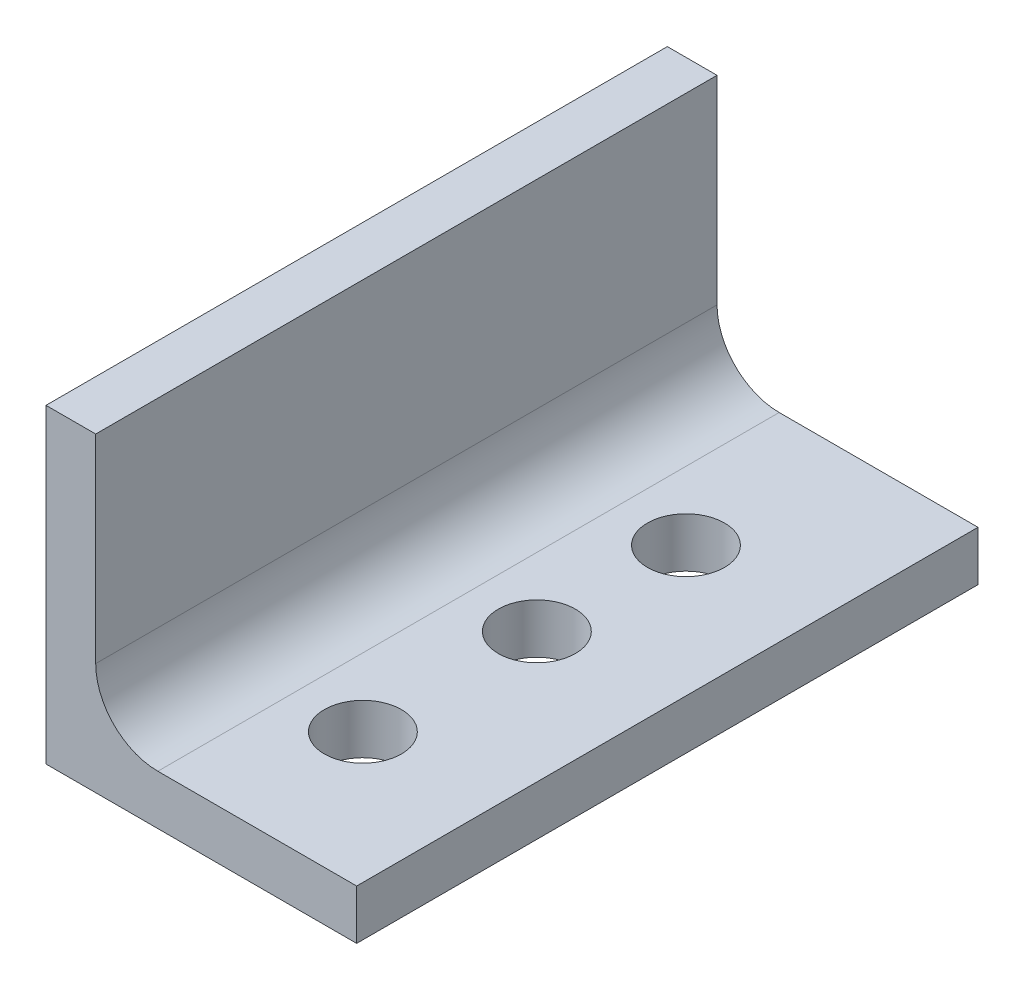
from build123d import *

# Parameters (mm, degrees)
BOSS_EXTRUDE1_DEPTH = 12.7
SKETCH3_R           = 0.7874
CUT_EXTRUDE1_DEPTH  = 2.54
FILLET1_R           = 1.27


with BuildPart() as part:
    # Sketch1 → Boss-Extrude1 (new body)
    with BuildSketch(Plane.XY):
        Polygon((-6.35, 6.35), (-6.35, 0), (0, 0), (0, 1.016), (-5.334, 1.016), (-5.334, 6.35), align=None)
    extrude(amount=BOSS_EXTRUDE1_DEPTH)

    # Sketch3 → Cut-Extrude1 (cut)
    with BuildSketch(Plane(origin=(0, 1.016, 0), x_dir=(1, 0, 0), z_dir=(0, 1, 0))):
        with Locations((-2.667, -9.906)):
            Circle(SKETCH3_R)
        with Locations((-2.667, -6.35)):
            Circle(SKETCH3_R)
        with Locations((-2.667, -3.302)):
            Circle(SKETCH3_R)
    extrude(amount=-CUT_EXTRUDE1_DEPTH, mode=Mode.SUBTRACT)

    # Fillet1
    fillet1_edges = [part.edges().sort_by_distance(p)[0] for p in [
        (-5.334, 1.016, 6.35),
    ]]
    fillet(fillet1_edges, radius=FILLET1_R)


solid = part.part
